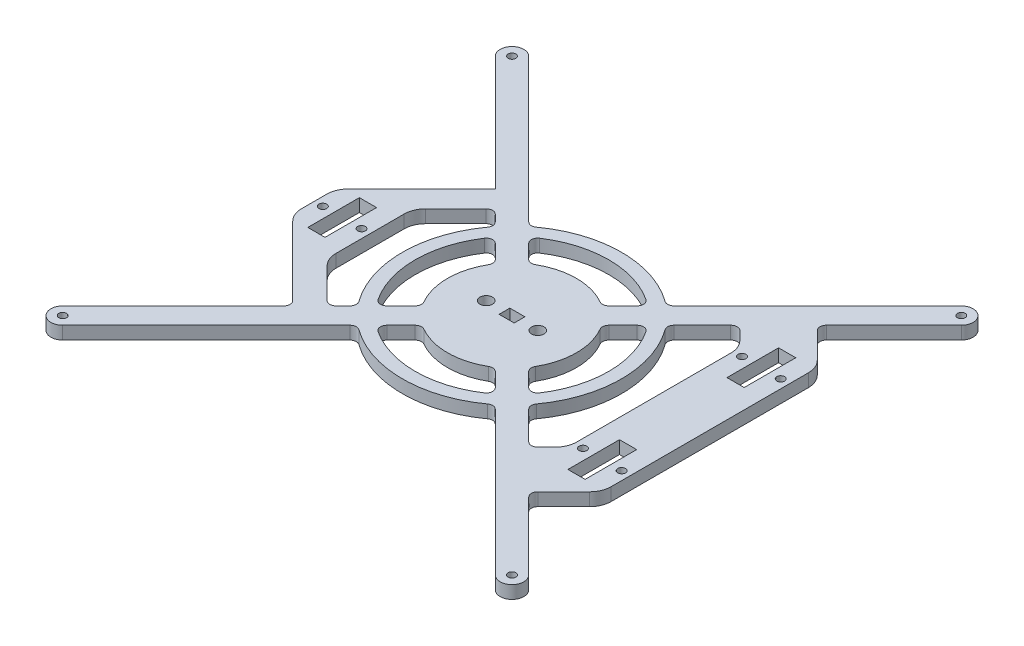
from build123d import *

# Parameters (mm, degrees)
SKETCH1_W            = 220
SKETCH1_H            = 220
SKETCH1_R            = 1.8
SKETCH1_W_2          = 8
SKETCH1_H_2          = 24
BOSS_EXTRUDE1_DEPTH  = 3
CUT_EXTRUDE1_DEPTH   = 10
FILLET1_R            = 3
M5_CLEARANCE_HOLE1_D = 5.8
SKETCH4_W            = 7
SKETCH4_H            = 5
CUT_EXTRUDE2_DEPTH   = 156.679157243


with BuildPart() as part:
    # Sketch1 → Boss-Extrude1 (new, symmetric)
    with BuildSketch(Plane(origin=(0, 0, 0), x_dir=(1, 0, 0), z_dir=(0, 1, 0))):
        Rectangle(SKETCH1_W, SKETCH1_H)
        with Locations((-104.5, 104.5)):
            Circle(SKETCH1_R, mode=Mode.SUBTRACT)
        with Locations((104.5, 104.5)):
            Circle(SKETCH1_R, mode=Mode.SUBTRACT)
        with Locations((104.5, -104.5)):
            Circle(SKETCH1_R, mode=Mode.SUBTRACT)
        with Locations((-104.5, -104.5)):
            Circle(SKETCH1_R, mode=Mode.SUBTRACT)
        with Locations((-70, 0)):
            Circle(SKETCH1_R, mode=Mode.SUBTRACT)
        with Locations((-88, 0)):
            Circle(SKETCH1_R, mode=Mode.SUBTRACT)
        with Locations((88, 37)):
            Circle(SKETCH1_R, mode=Mode.SUBTRACT)
        with Locations((70, 37)):
            Circle(SKETCH1_R, mode=Mode.SUBTRACT)
        with Locations((88, -37)):
            Circle(SKETCH1_R, mode=Mode.SUBTRACT)
        with Locations((70, -37)):
            Circle(SKETCH1_R, mode=Mode.SUBTRACT)
        with Locations((-79, 0)):
            Rectangle(SKETCH1_W_2, SKETCH1_H_2, mode=Mode.SUBTRACT)
        with Locations((79, 37)):
            Rectangle(SKETCH1_W_2, SKETCH1_H_2, mode=Mode.SUBTRACT)
        with Locations((79, -37)):
            Rectangle(SKETCH1_W_2, SKETCH1_H_2, mode=Mode.SUBTRACT)
    extrude(amount=BOSS_EXTRUDE1_DEPTH, both=True)

    # Sketch2 → Cut-Extrude1 (cut)
    with BuildSketch(Plane.XZ.offset(3)):
        with BuildLine():
            Line((-104.500000026, 110), (-110, 110))
            Line((-110, 110), (-110, 104.5))
            ThreePointArc((-110, 104.5), (-108.389087306, 108.389087287), (-104.500000026, 110))
        make_face()
        with BuildLine():
            Line((104.5, 110), (-104.500000026, 110))
            ThreePointArc((-104.500000026, 110), (-102.395241134, 109.581337434), (-100.610912703, 108.389087297))
            Line((-100.610912703, 108.389087297), (-31.963039558, 39.741214151))
            ThreePointArc((-31.963039558, 39.741214151), (0, 51), (31.963039558, 39.741214151))
            Line((31.963039558, 39.741214151), (100.610912703, 108.389087297))
            ThreePointArc((100.610912703, 108.389087297), (102.395241122, 109.581337429), (104.5, 110))
        make_face()
        with BuildLine():
            ThreePointArc((-108.389087297, 100.610912703), (-109.581337429, 102.395241122), (-110, 104.5))
            Line((-110, 104.5), (-110, -104.50000001))
            ThreePointArc((-110, -104.50000001), (-109.581337431, -102.395241127), (-108.389087297, -100.610912703))
            Line((-108.389087297, -100.610912703), (-54.889087297, -47.110912703))
            Line((-54.889087297, -47.110912703), (-89.071067812, -12.928932188))
            ThreePointArc((-89.071067812, -12.928932188), (-91.238795325, -9.6846987), (-92, -5.857864376))
            Line((-92, -5.857864376), (-92, 5.857864376))
            ThreePointArc((-92, 5.857864376), (-91.238795325, 9.6846987), (-89.071067812, 12.928932188))
            Line((-89.071067812, 12.928932188), (-54.889087297, 47.110912703))
            Line((-54.889087297, 47.110912703), (-108.389087297, 100.610912703))
        make_face()
        with BuildLine():
            Line((110, 110), (104.5, 110))
            ThreePointArc((104.5, 110), (108.389087297, 108.389087297), (110, 104.5))
            Line((110, 104.5), (110, 110))
        make_face()
        with BuildLine():
            ThreePointArc((-104.5, -110), (-108.389087293, -108.3890873), (-110, -104.50000001))
            Line((-110, -104.50000001), (-110, -110))
            Line((-110, -110), (-104.5, -110))
        make_face()
        with BuildLine():
            Line((110, -104.5), (110, 104.5))
            ThreePointArc((110, 104.5), (109.581337429, 102.395241122), (108.389087297, 100.610912703))
            Line((108.389087297, 100.610912703), (74.889087297, 67.110912703))
            Line((74.889087297, 67.110912703), (89.071067812, 52.928932188))
            ThreePointArc((89.071067812, 52.928932188), (91.238795325, 49.6846987), (92, 45.857864376))
            Line((92, 45.857864376), (92, -45.857864376))
            ThreePointArc((92, -45.857864376), (91.238795325, -49.6846987), (89.071067812, -52.928932188))
            Line((89.071067812, -52.928932188), (74.889087297, -67.110912703))
            Line((74.889087297, -67.110912703), (108.389087297, -100.610912703))
            ThreePointArc((108.389087297, -100.610912703), (109.581337429, -102.395241122), (110, -104.5))
        make_face()
        with BuildLine():
            ThreePointArc((-100.610912703, -108.389087297), (-102.395241122, -109.581337429), (-104.5, -110))
            Line((-104.5, -110), (104.5, -110))
            ThreePointArc((104.5, -110), (102.395241122, -109.581337429), (100.610912703, -108.389087297))
            Line((100.610912703, -108.389087297), (31.963039558, -39.741214151))
            ThreePointArc((31.963039558, -39.741214151), (0, -51), (-31.963039558, -39.741214151))
            Line((-31.963039558, -39.741214151), (-100.610912703, -108.389087297))
        make_face()
        with BuildLine():
            Line((110, -110), (110, -104.5))
            ThreePointArc((110, -104.5), (108.389087297, -108.389087297), (104.5, -110))
            Line((104.5, -110), (110, -110))
        make_face()
        with BuildLine():
            ThreePointArc((27.692157137, 35.470331731), (0, 45), (-27.692157137, 35.470331731))
            Line((-27.692157137, 35.470331731), (-16.964569457, 24.74274405))
            ThreePointArc((-16.964569457, 24.74274405), (0, 30), (16.964569457, 24.74274405))
            Line((16.964569457, 24.74274405), (27.692157137, 35.470331731))
        make_face()
        with BuildLine():
            ThreePointArc((-39.741214151, -31.963039558), (-51, 0), (-39.741214151, 31.963039558))
            Line((-39.741214151, 31.963039558), (-46.889087297, 39.110912703))
            Line((-46.889087297, 39.110912703), (-63.071067812, 22.928932188))
            ThreePointArc((-63.071067812, 22.928932188), (-65.238795325, 19.6846987), (-66, 15.857864376))
            Line((-66, 15.857864376), (-66, -15.857864376))
            ThreePointArc((-66, -15.857864376), (-65.238795325, -19.6846987), (-63.071067812, -22.928932188))
            Line((-63.071067812, -22.928932188), (-46.889087297, -39.110912703))
            Line((-46.889087297, -39.110912703), (-39.741214151, -31.963039558))
        make_face()
        with BuildLine():
            Line((56.889087297, 49.110912703), (39.741214151, 31.963039558))
            ThreePointArc((39.741214151, 31.963039558), (51, 0), (39.741214151, -31.963039558))
            Line((39.741214151, -31.963039558), (56.889087297, -49.110912703))
            Line((56.889087297, -49.110912703), (63.071067812, -42.928932188))
            ThreePointArc((63.071067812, -42.928932188), (65.238795325, -39.6846987), (66, -35.857864376))
            Line((66, -35.857864376), (66, 35.857864376))
            ThreePointArc((66, 35.857864376), (65.238795325, 39.6846987), (63.071067812, 42.928932188))
            Line((63.071067812, 42.928932188), (56.889087297, 49.110912703))
        make_face()
        with BuildLine():
            Line((-24.74274405, 16.964569457), (-35.470331731, 27.692157137))
            ThreePointArc((-35.470331731, 27.692157137), (-45, 0), (-35.470331731, -27.692157137))
            Line((-35.470331731, -27.692157137), (-24.74274405, -16.964569457))
            ThreePointArc((-24.74274405, -16.964569457), (-30, 0), (-24.74274405, 16.964569457))
        make_face()
        with BuildLine():
            ThreePointArc((35.470331731, -27.692157137), (45, 0), (35.470331731, 27.692157137))
            Line((35.470331731, 27.692157137), (24.74274405, 16.964569457))
            ThreePointArc((24.74274405, 16.964569457), (30, 0), (24.74274405, -16.964569457))
            Line((24.74274405, -16.964569457), (35.470331731, -27.692157137))
        make_face()
        with BuildLine():
            Line((-16.964569457, -24.74274405), (-27.692157137, -35.470331731))
            ThreePointArc((-27.692157137, -35.470331731), (0, -45), (27.692157137, -35.470331731))
            Line((27.692157137, -35.470331731), (16.964569457, -24.74274405))
            ThreePointArc((16.964569457, -24.74274405), (0, -30), (-16.964569457, -24.74274405))
        make_face()
    extrude(amount=-CUT_EXTRUDE1_DEPTH, mode=Mode.SUBTRACT)

    # Fillet1
    fillet1_edges = [part.edges().sort_by_distance(p)[0] for p in [
        (-39.741214151, 0, 31.963039558),
        (-31.963039558, 0, -39.741214151),
        (-39.741214151, 0, -31.963039558),
        (-24.74274405, 0, -16.964569457),
        (-24.74274405, 0, 16.964569457),
        (-35.470331731, 0, 27.692157137),
        (-35.470331731, 0, -27.692157137),
        (-27.692157137, 0, -35.470331731),
        (27.692157137, 0, -35.470331731),
        (-16.964569457, 0, -24.74274405),
        (16.964569457, 0, -24.74274405),
        (31.963039558, 0, -39.741214151),
        (39.741214151, 0, -31.963039558),
        (24.74274405, 0, -16.964569457),
        (35.470331731, 0, -27.692157137),
        (24.74274405, 0, 16.964569457),
        (16.964569457, 0, 24.74274405),
        (-16.964569457, 0, 24.74274405),
        (35.470331731, 0, 27.692157137),
        (39.741214151, 0, 31.963039558),
        (27.692157137, 0, 35.470331731),
        (31.963039558, 0, 39.741214151),
        (-27.692157137, 0, 35.470331731),
        (-31.963039558, 0, 39.741214151),
        (74.889087297, 0, -67.110912703),
        (-46.889087297, 0, -39.110912703),
        (56.889087297, 0, -49.110912703),
        (56.889087297, 0, 49.110912703),
        (74.889087297, 0, 67.110912703),
        (-54.889087297, 0, 47.110912703),
        (-46.889087297, 0, 39.110912703),
    ]]
    fillet(fillet1_edges, radius=FILLET1_R)

    # M5 Clearance Hole1 (through all)
    with Locations(Plane(origin=(-12, -3, 0), x_dir=(0, 0, -1), z_dir=(0, -1, 0))):
        with Locations((0, 0), (0, 24)):
            Hole(M5_CLEARANCE_HOLE1_D / 2)

    # Sketch4 → Cut-Extrude2 (cut, through all)
    with BuildSketch(Plane(origin=(0, 3, 0), x_dir=(1, 0, 0), z_dir=(0, 1, 0))):
        Rectangle(SKETCH4_W, SKETCH4_H)
    extrude(amount=-CUT_EXTRUDE2_DEPTH, mode=Mode.SUBTRACT)


solid = part.part
